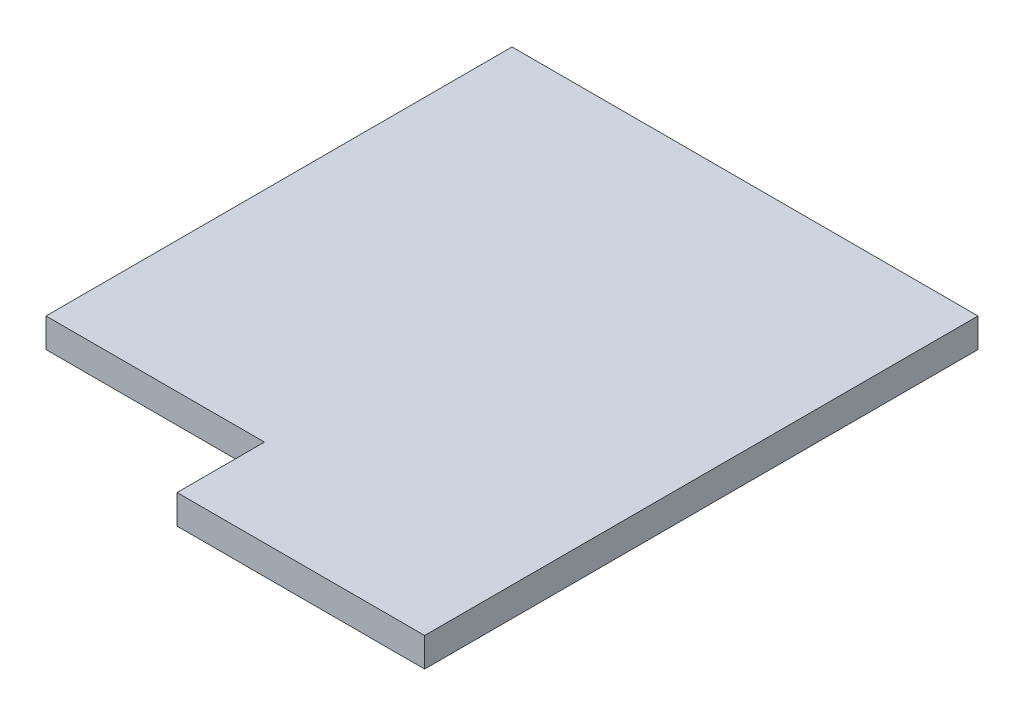
from build123d import *

# Parameters (mm, degrees)
BOSS_EXTRUDE1_DEPTH = 3.175


with BuildPart() as part:
    # Sketch1 → Boss-Extrude1 (new body)
    with BuildSketch(Plane(origin=(0, 0, 0), x_dir=(1, 0, 0), z_dir=(0, 1, 0))):
        Polygon((-25.4, -25.4), (-1.5875, -25.4), (-1.5875, -34.925), (25.4, -34.925), (25.4, -25.4), (25.4, 25.4), (-25.4, 25.4), align=None)
    extrude(amount=BOSS_EXTRUDE1_DEPTH)


solid = part.part
